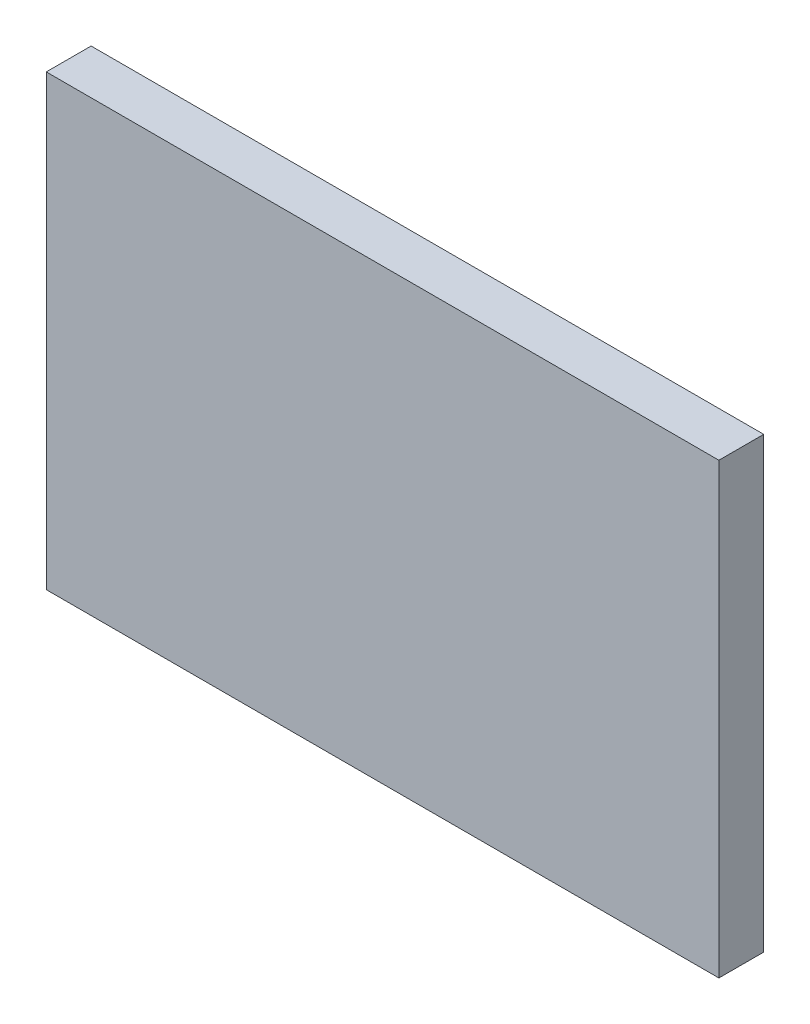
from build123d import *

# Parameters (mm, degrees)
SKIZZE1_W                       = 30
SKIZZE1_H                       = 20
AUFSATZ_LINEAR_AUSTRAGEN1_DEPTH = 2


with BuildPart() as part:
    # Skizze1 → Aufsatz-Linear austragen1 (new body)
    with BuildSketch(Plane.XY):
        with Locations((15, 10)):
            Rectangle(SKIZZE1_W, SKIZZE1_H)
    extrude(amount=AUFSATZ_LINEAR_AUSTRAGEN1_DEPTH)


solid = part.part
